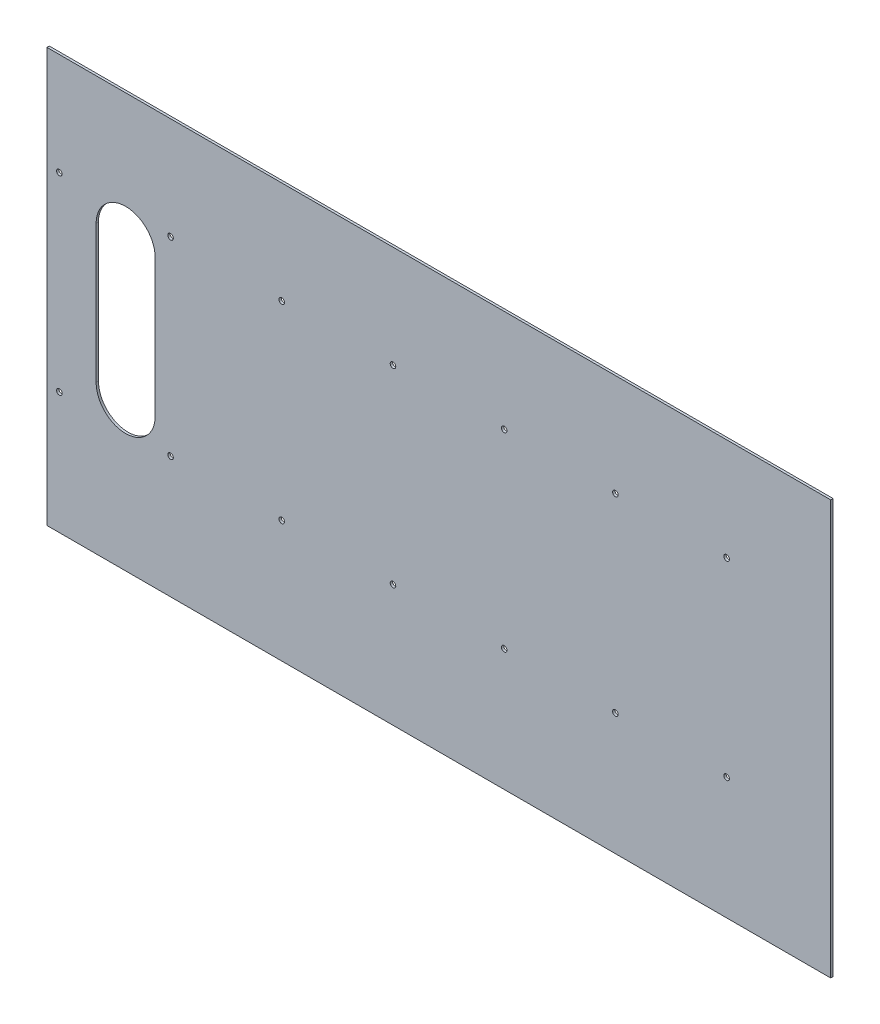
from build123d import *

# Parameters (mm, degrees)
SKETCH1_W                = 506
SKETCH1_H                = 267.33784
BASE_FLANGE1_DEPTH       = 1.51892
CUT_EXTRUDE1_DEPTH       = 2.54
M3_CLEARANCE_HOLE1_D     = 3.6
M3_CLEARANCE_HOLE1_DEPTH = 11.938
M3_CLEARANCE_HOLE1_TIP   = 1.081549114


# Sheet-metal steps are written as plain solids
with BuildPart() as part:
    # Sketch1 → Base-Flange1 (new body)
    with BuildSketch(Plane.XY):
        with Locations((-172.1425, 68.65)):
            Rectangle(SKETCH1_W, SKETCH1_H)
    extrude(amount=BASE_FLANGE1_DEPTH)

    # Sketch6 → Cut-Extrude1 (cut)
    with BuildSketch(Plane.XY.offset(1.51892)):
        with BuildLine():
            Line((-393.3925, 30.86892), (-393.3925, 119.76892))
            ThreePointArc((-393.3925, 119.76892), (-374.3425, 138.81892), (-355.2925, 119.76892))
            Line((-355.2925, 119.76892), (-355.2925, 30.86892))
            ThreePointArc((-355.2925, 30.86892), (-374.3425, 11.81892), (-393.3925, 30.86892))
        make_face()
    extrude(amount=-CUT_EXTRUDE1_DEPTH, mode=Mode.SUBTRACT)

    # M3 Clearance Hole1
    with Locations(Plane.XY.offset(1.51892)):
        with Locations((-417.1425, 136.3375), (-417.1425, 13.6625), (-345.341667, 136.3375), (-345.341667, 13.6625), (-273.540834, 136.3375), (-273.540834, 13.6625), (-201.740001, 136.3375), (-201.740001, 13.6625), (-129.939168, 136.3375), (-129.939168, 13.6625), (-58.138335, 136.3375), (-58.138335, 13.6625), (13.662498, 136.3375), (13.662498, 13.6625)):
            Hole(M3_CLEARANCE_HOLE1_D / 2, depth=M3_CLEARANCE_HOLE1_DEPTH)
            with Locations((0, 0, -(M3_CLEARANCE_HOLE1_DEPTH + M3_CLEARANCE_HOLE1_TIP / 2))):  # 118° drill point
                Cone(0, M3_CLEARANCE_HOLE1_D / 2, M3_CLEARANCE_HOLE1_TIP, mode=Mode.SUBTRACT)


solid = part.part
